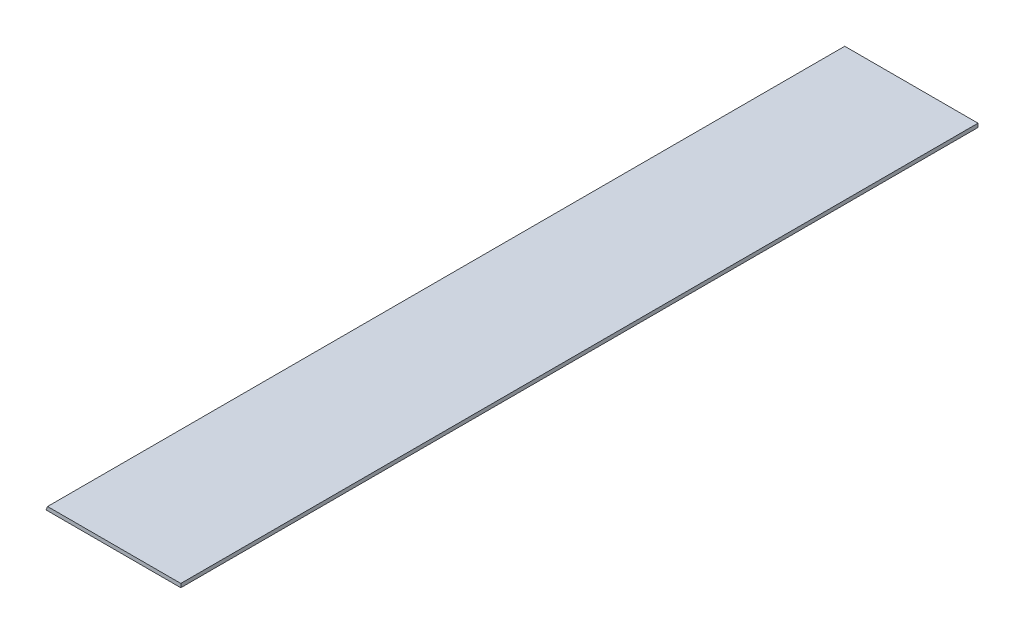
from build123d import *

# Parameters (mm, degrees)
BOSS_EXTRUDE1_DEPTH = 501.65


with BuildPart() as part:
    # Sketch1 → Boss-Extrude1 (new body)
    with BuildSketch(Plane.XY):
        Polygon((0, 0), (0.978455277, 2.3622), (84.836, 2.3622), (84.836, 0), align=None)
    extrude(amount=BOSS_EXTRUDE1_DEPTH)


solid = part.part
